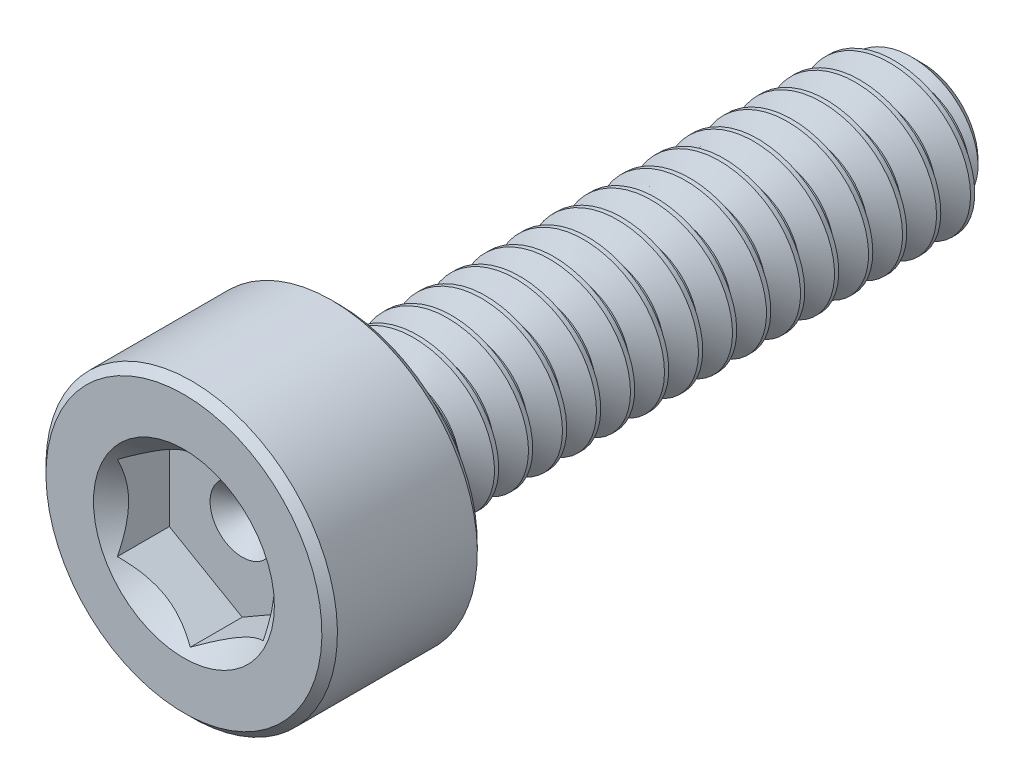
from build123d import *

# Parameters (mm, degrees)
CUT_EXTRUDE1_DEPTH     = 0.6
SKETCH4_R              = 0.930977309
CUT_EXTRUDE2_DEPTH     = 0.8
CUT_EXTRUDE2_DRAFT     = -45
SPLIT1_SURFACE_1_BACK  = 9.704
SPLIT1_SURFACE_1_DEPTH = 19.408
SPLIT1_SURFACE_2_BACK  = 9.704
SPLIT1_SURFACE_2_DEPTH = 19.408
CUT_SWEEP1_PITCH       = 0.35


with BuildPart() as part:
    # Sketch2 → Revolve1 (revolve)
    with BuildSketch(Plane(origin=(0, 0, 0), x_dir=(0, 0, -1), z_dir=(1, 0, 0))):
        with BuildLine():
            Line((-3.8, 0), (-3.8, 1.42))
            Line((-3.8, 1.42), (-3.72, 1.5))
            Line((-3.72, 1.5), (-2.28, 1.5))
            Line((-2.28, 1.5), (-2.2, 1.42))
            Line((-2.2, 1.42), (-2.2, 0.88))
            ThreePointArc((-2.2, 0.88), (-2.176568542, 0.823431458), (-2.12, 0.8))
            Line((-2.12, 0.8), (3.572668332, 0.8))
            Line((3.572668332, 0.8), (3.8, 0.572668332))
            Line((3.8, 0.572668332), (3.8, 0))
            Line((3.8, 0), (-3.8, 0))
        make_face()
    revolve(axis=Axis((0, 0, -3.8), (0, 0, 1)))

    # Sketch3 → Cut-Extrude1 (cut)
    with BuildSketch(Plane.XY.offset(3.8)):
        Polygon((0.75, -0.433012702), (0.75, 0.433012702), (0, 0.866025404), (-0.75, 0.433012702), (-0.75, -0.433012702), (0, -0.866025404), align=None)
    extrude(amount=-CUT_EXTRUDE1_DEPTH, mode=Mode.SUBTRACT)


with BuildPart() as cut_extrude2_tool:
    # Sketch4 → Cut-Extrude2 (with draft: the straight prism first)
    with BuildSketch(Plane.XY.offset(3.8)):
        Circle(SKETCH4_R)
    extrude(amount=-CUT_EXTRUDE2_DEPTH)
    # Cut-Extrude2: the draft: its side faces are tilted about the plane it starts from
    cut_extrude2_sides = [cut_extrude2_tool.faces().sort_by_distance(p)[0] for p in [
        (-0.930977309, 0, 3.4),
    ]]
    draft(cut_extrude2_sides, Plane.XY.offset(3.8), CUT_EXTRUDE2_DRAFT)


with BuildPart() as part_1:
    add(part.part)

    # Cut-Extrude2: cut by cut_extrude2_tool
    add(cut_extrude2_tool.part, mode=Mode.SUBTRACT)


with BuildPart() as body_2:
    # Split1: the piece behind the surface
    add(part_1.part)
    # Split1 surface: a surface, the sketch's curves swept straight by 19.408 mm
    with BuildLine(Plane(origin=(0, 0, 0), x_dir=(0, 0, -1), z_dir=(1, 0, 0)).offset(-SPLIT1_SURFACE_1_BACK), mode=Mode.PRIVATE) as split1_surface_1_path:
        Line((-2.12, -1.5), (-2.12, 1.5))
    split1_surface_1 = Shell.extrude(split1_surface_1_path.wire(), (1 * SPLIT1_SURFACE_1_DEPTH, 0 * SPLIT1_SURFACE_1_DEPTH, 0 * SPLIT1_SURFACE_1_DEPTH))
    split(bisect_by=split1_surface_1, keep=Keep.BOTTOM)

    # Cut-Sweep1: the profile of Sketch7 screwed along a right-hand helix of 18.142857 turns, 6 arcs to a turn; built about Z, then put on its axis
    cut_sweep1_z = Axis((0, 0, 0), (0, 0, 1))
    cut_sweep1_corners = [(0.818944306, 0, 0.0109375), (0.818944306, 0, -0.3171875), (0.572668332, 0, -0.175), (0.572668332, 0, -0.13125)]
    with BuildLine(mode=Mode.PRIVATE) as cut_sweep1_profile:
        Line(cut_sweep1_corners[0], cut_sweep1_corners[1])
        Line(cut_sweep1_corners[1], cut_sweep1_corners[2])
        Line(cut_sweep1_corners[2], cut_sweep1_corners[3])
        Line(cut_sweep1_corners[3], cut_sweep1_corners[0])
    cut_sweep1_cap = Face(cut_sweep1_profile.wire())
    cut_sweep1_turn_angles = [0, 30, 60, 90, 120, 150, 180, 210, 240, 270, 300, 330, 360]
    cut_sweep1_turn_weights = [1, 0.8660254037844387, 1, 0.8660254037844387, 1, 0.8660254037844387, 1, 0.8660254037844387, 1, 0.8660254037844387, 1, 0.8660254037844387, 1]
    cut_sweep1_turn_rails = [Edge.make_bspline([Vector(p[0], p[1], 0).rotate(cut_sweep1_z, cut_sweep1_turn_angles[k]) / cut_sweep1_turn_weights[k] + Vector(0, 0, p[2] + CUT_SWEEP1_PITCH * cut_sweep1_turn_angles[k] / 360) for k in range(13)], [0, 0, 0, 1, 1, 2, 2, 3, 3, 4, 4, 5, 5, 6, 6, 6], 2, cut_sweep1_turn_weights) for p in cut_sweep1_corners]
    cut_sweep1_turn_sides = [Face.make_surface_from_curves(cut_sweep1_turn_rails[p[0]], cut_sweep1_turn_rails[p[1]]) for p in [(0, 1), (1, 2), (2, 3), (3, 0)]]
    cut_sweep1_last_angles = [6480, 6505.714285714, 6531.428571429]
    cut_sweep1_last_weights = [1, 0.9009688679025564, 1]
    cut_sweep1_last_rails = [Edge.make_bspline([Vector(p[0], p[1], 0).rotate(cut_sweep1_z, cut_sweep1_last_angles[k]) / cut_sweep1_last_weights[k] + Vector(0, 0, p[2] + CUT_SWEEP1_PITCH * cut_sweep1_last_angles[k] / 360) for k in range(3)], [0, 0, 0, 1, 1, 1], 2, cut_sweep1_last_weights) for p in cut_sweep1_corners]
    cut_sweep1_last_sides = [Face.make_surface_from_curves(cut_sweep1_last_rails[p[0]], cut_sweep1_last_rails[p[1]]) for p in [(0, 1), (1, 2), (2, 3), (3, 0)]]
    cut_sweep1 = Plane(origin=(0, 0, -3.8), x_dir=(0, 1, 0), z_dir=(0, 0, 1)) * Solid(Shell([*[p.moved(Location((0, 0, CUT_SWEEP1_PITCH * i))) for i in range(18) for p in cut_sweep1_turn_sides], *cut_sweep1_last_sides, cut_sweep1_cap, cut_sweep1_cap.rotate(cut_sweep1_z, 6531.428571429).moved(Location((0, 0, CUT_SWEEP1_PITCH * 6531.428571429 / 360)))]))
    add(cut_sweep1, mode=Mode.SUBTRACT)


with BuildPart() as part_2:
    add(part_1.part)

    # Split1: split by a surface, the side it looks to stays
    # Split1 surface: a surface, the sketch's curves swept straight by 19.408 mm
    with BuildLine(Plane(origin=(0, 0, 0), x_dir=(0, 0, -1), z_dir=(1, 0, 0)).offset(-SPLIT1_SURFACE_2_BACK), mode=Mode.PRIVATE) as split1_surface_2_path:
        Line((-2.12, -1.5), (-2.12, 1.5))
    split1_surface_2 = Shell.extrude(split1_surface_2_path.wire(), (1 * SPLIT1_SURFACE_2_DEPTH, 0 * SPLIT1_SURFACE_2_DEPTH, 0 * SPLIT1_SURFACE_2_DEPTH))
    split(bisect_by=split1_surface_2, keep=Keep.TOP)

    add(body_2.part)  # Revolve2 merges body 2
    # Sketch8 → Revolve2 (revolve)
    with BuildSketch(Plane(origin=(0, 0, 0), x_dir=(0, 0, -1), z_dir=(1, 0, 0))):
        Polygon((-2.2, 0), (-2.2, 0.8), (-2.12, 0.8), (-1.658119785, 0), align=None)
    revolve(axis=Axis((0, 0, 1.658119785), (0, 0, 1)))


solid = part_2.part
